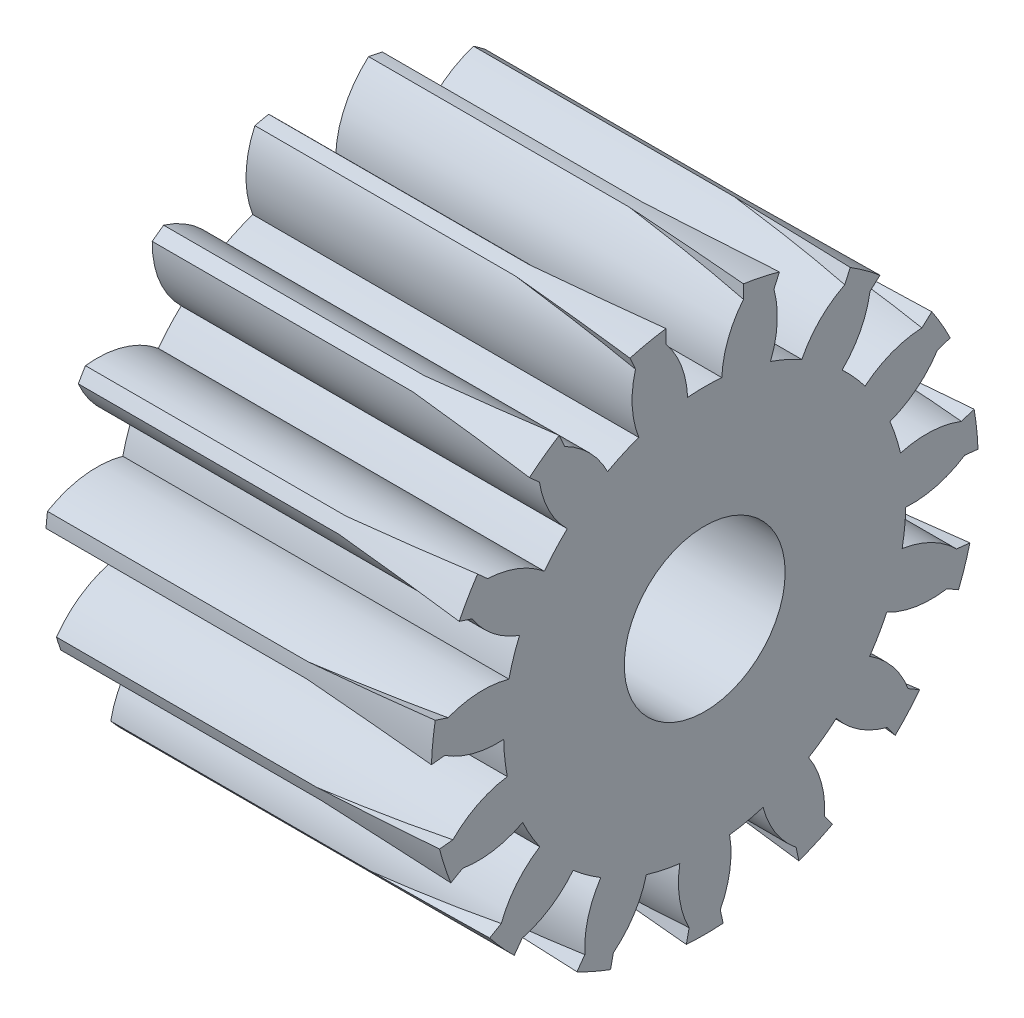
from build123d import *
from build123d.topology import SkipClean

# Parameters (mm, degrees)
BASPROSKE_W                               = 30
BASPROSKE_H                               = 8.5
TOOTHCUT_DEPTH                            = 33.318725222
TEETHCUTS_COUNT                           = 15
TEETHCUTS_ANGLE                           = 336
BORSKE_R                                  = 3
BORE_DEPTH                                = 50.0000508
ESBO_O1_R                                 = 8.5
ESBO_O1_R_2                               = 3
RESSALTO_EXTRUS_O1_DEPTH                  = 10
RESSALTO_EXTRUS_O2_REACH                  = 37.644
RESSALTO_EXTRUS_O2_END_RADIUS             = 6.249
RESSALTO_EXTRUS_O2_DIRECTION_2_REACH      = 37.644
RESSALTO_EXTRUS_O2_DIRECTION_2_END_RADIUS = 8.5
PADR_OCIRCULAR1_COUNT                     = 15
ESBO_O3_R                                 = 4
CORTE_EXTRUS_O1_DEPTH                     = 33.318725368
CHANFRO1_SIZE                             = 0.5
ESBO_O4_R                                 = 12.089126148
CORTE_EXTRUS_O2_DEPTH                     = 2
ESBO_O5_R                                 = 10.551181847
CORTE_EXTRUS_O3_DEPTH                     = 16
RESSALTO_EXTRUS_O3_START                  = -12
ESBO_O6_R                                 = 4
ESBO_O6_R_2                               = 3
RESSALTO_EXTRUS_O3_DEPTH                  = 12
PADR_O_LINEAR2_COUNT                      = 2
PADR_O_LINEAR2_PITCH                      = 1
PADR_O_LINEAR2_COL_COUNT                  = 11
PADR_O_LINEAR2_COL_PITCH                  = 1
ESBO_O10_R                                = 4.09987249
ESBO_O10_R_2                              = 2.5
RESSALTO_EXTRUS_O4_DEPTH                  = 12


# Read off the part's stored shape, not the designer's step: Corte-Revolução3
with BuildPart() as part:
    # BasProSke → Base-Revolve (revolve)
    with BuildSketch(Plane(origin=(0, 0, 0), x_dir=(1, 0, 0), z_dir=(0, 1, 0)), mode=Mode.PRIVATE) as base_revolve_sk:
        with Locations((15, 4.25)):
            Rectangle(BASPROSKE_W, BASPROSKE_H)
    revolve(base_revolve_sk.sketch.rotate(Axis((-10, 0, 0), (1, 0, 0)), 180), axis=Axis((-10, 0, 0), (1, 0, 0)))

    # TooCutSke → ToothCut (cut, through all)
    with BuildSketch(Plane(origin=(0, 0, 0), x_dir=(0, 0, -1), z_dir=(1, 0, 0))):
        with BuildLine():
            ThreePointArc((0.531576138, 6.226349477), (0, 6.249), (-0.531576138, 6.226349477))
            ThreePointArc((-0.531576138, 6.226349477), (-0.830301624, 7.411024729), (-1.576608494, 8.378350125))
            ThreePointArc((-1.576608494, 8.378350125), (0, 8.5254), (1.576608494, 8.378350125))
            ThreePointArc((1.576608494, 8.378350125), (0.830301624, 7.411024729), (0.531576138, 6.226349477))
        make_face()
    toothcut = extrude(amount=TOOTHCUT_DEPTH, mode=Mode.SUBTRACT)

    # TeethCuts: ToothCut ×15 about axis
    teethcuts_axis = Axis((-10, 0, 0), (1, 0, 0))
    for i in range(1, TEETHCUTS_COUNT):
        add(toothcut.rotate(teethcuts_axis, i * TEETHCUTS_ANGLE / (TEETHCUTS_COUNT - 1)), mode=Mode.SUBTRACT)

    # BorSke → Bore (cut, symmetric)
    with BuildSketch(Plane(origin=(0, 0, 0), x_dir=(0, 0, -1), z_dir=(1, 0, 0))):
        with Locations(Location((0, 0, 0), (0, 0, 180))):
            Circle(BORSKE_R)
    extrude(amount=BORE_DEPTH, both=True, mode=Mode.SUBTRACT)

    # Esboço1 → Ressalto-extrusão1 (add)
    with BuildSketch(Plane(origin=(30, 0, 0), x_dir=(0, 0, -1), z_dir=(1, 0, 0))):
        with Locations(Location((0, 0, 0), (0, 0, 180))):
            Circle(ESBO_O1_R)
        with Locations(Location((0, 0, 0), (0, 0, 180))):
            Circle(ESBO_O1_R_2, mode=Mode.SUBTRACT)
    extrude(amount=-RESSALTO_EXTRUS_O1_DEPTH)

    # Ressalto-extrusão2: up to this cylinder (the profile starts outside it)
    ressalto_extrus_o2_end = Plane(origin=(19.989625, 0, 0), z_dir=(-1, 0, 0)) * Cylinder(RESSALTO_EXTRUS_O2_END_RADIUS, 88.786, mode=Mode.PRIVATE)
    # Esboço2 → Ressalto-extrusão2 (add, up to the surface)
    with BuildSketch(Plane(origin=(0, -0.873554359, 8.311314547), x_dir=(1, 0, 0), z_dir=(0, -0.10452846326765765, 0.994521895368273)), mode=Mode.PRIVATE) as ressalto_extrus_o2_sk1:
        with BuildLine():
            Line((20, 1.55208031), (20, -1.55208031))
            Line((20, -1.55208031), (10.1, -1.55208031))
            add(Edge.make_bspline(
                [(10.1, 1.55208031), (29.7, 0), (10.1, -1.55208031)],
                knots=[0, 0, 0, 1, 1, 1], degree=2))
            Line((10.1, 1.55208031), (20, 1.55208031))
        make_face()
    ressalto_extrus_o2_tool1 = extrude(ressalto_extrus_o2_sk1.sketch, amount=-RESSALTO_EXTRUS_O2_REACH, mode=Mode.PRIVATE) - ressalto_extrus_o2_end
    ressalto_extrus_o2 = ressalto_extrus_o2_tool1.solids().sort_by_distance((19.989625, -0.873554, 8.311315))[0]
    add(ressalto_extrus_o2)

    # Ressalto-extrusão2 direction 2: up to this cylinder (the profile starts inside it)
    ressalto_extrus_o2_direction_2_end = Plane(origin=(19.989625, 0, 0), z_dir=(-1, 0, 0)) * Cylinder(RESSALTO_EXTRUS_O2_DIRECTION_2_END_RADIUS, 93.288, mode=Mode.PRIVATE)
    # Esboço2 → Ressalto-extrusão2 direction 2 (add, up to the surface)
    with BuildSketch(Plane(origin=(0, -0.873554359, 8.311314547), x_dir=(1, 0, 0), z_dir=(0, -0.10452846326765765, 0.994521895368273)), mode=Mode.PRIVATE) as ressalto_extrus_o2_direction_2_sk1:
        with BuildLine():
            Line((20, 1.55208031), (20, -1.55208031))
            Line((20, -1.55208031), (10.1, -1.55208031))
            add(Edge.make_bspline(
                [(10.1, 1.55208031), (29.7, 0), (10.1, -1.55208031)],
                knots=[0, 0, 0, 1, 1, 1], degree=2))
            Line((10.1, 1.55208031), (20, 1.55208031))
        make_face()
    ressalto_extrus_o2_direction_2_tool1 = extrude(ressalto_extrus_o2_direction_2_sk1.sketch, amount=RESSALTO_EXTRUS_O2_DIRECTION_2_REACH, mode=Mode.PRIVATE) & ressalto_extrus_o2_direction_2_end
    ressalto_extrus_o2_direction_2 = ressalto_extrus_o2_direction_2_tool1.solids().sort_by_distance((19.989625, -0.873554, 8.311315))[0]
    add(ressalto_extrus_o2_direction_2)
    ressalto_extrus_o2 = ressalto_extrus_o2 + ressalto_extrus_o2_direction_2  # both directions under the feature's name, for the pattern or mirror that repeats it

    # PadrãoCircular1: Ressalto-extrusão2 ×15 about axis
    padr_ocircular1_axis = Axis((0, 0, 0), (1, 0, 0))
    for i in range(1, PADR_OCIRCULAR1_COUNT):
        add(ressalto_extrus_o2.rotate(padr_ocircular1_axis, i * 360 / PADR_OCIRCULAR1_COUNT))

    # Esboço3 → Corte-extrusão1 (cut, through all)
    with BuildSketch(Plane.ZY):
        Circle(ESBO_O3_R)
    extrude(amount=-CORTE_EXTRUS_O1_DEPTH, mode=Mode.SUBTRACT)

    # Chanfro1
    chanfro1_edges = [part.edges().sort_by_distance(p)[0] for p in [
        (30, 6.536156464, 5.434027851),
        (30, 0, -4),
    ]]
    chamfer(chanfro1_edges, length=CHANFRO1_SIZE)

    # Esboço4 → Corte-extrusão2 (cut)
    with BuildSketch(Plane.ZY):
        Circle(ESBO_O4_R)
    extrude(amount=-CORTE_EXTRUS_O2_DEPTH, mode=Mode.SUBTRACT)

    # Esboço5 → Corte-extrusão3 (cut)
    with BuildSketch(Plane(origin=(30, 0, 0), x_dir=(0, 0, -1), z_dir=(1, 0, 0))):
        Circle(ESBO_O5_R)
    extrude(amount=-CORTE_EXTRUS_O3_DEPTH, mode=Mode.SUBTRACT)

    # Esboço6 → Ressalto-extrusão3 (add)
    with BuildSketch(Plane(origin=(14, 0, 0), x_dir=(0, 0, -1), z_dir=(1, 0, 0)).offset(RESSALTO_EXTRUS_O3_START)):
        Circle(ESBO_O6_R)
        Circle(ESBO_O6_R_2, mode=Mode.SUBTRACT)
    extrude(amount=RESSALTO_EXTRUS_O3_DEPTH)

    # Corte-Revolução3 outline → Corte-Revolução3 (revolve, cut)
    with BuildSketch(Plane.YX):
        Polygon((4.018103451, 12.575), (3, 13.007693967), (3, 11.992306033), (4.018103451, 12.425), align=None)
    corte_revolu_o3 = revolve(axis=Axis((0, 0, 0), (1, 0, 0)), mode=Mode.SUBTRACT)

    # Padrão linear2: Corte-Revolução3 ×2
    with SkipClean():  # the faces are left unmerged after this step: merging them gives an invalid solid
        with Locations(*[(i * PADR_O_LINEAR2_PITCH, 0, 0) for i in range(1, PADR_O_LINEAR2_COUNT)]):
            add(corte_revolu_o3, mode=Mode.SUBTRACT)

    # Padrão linear2 col: Corte-Revolução3 ×11
    with SkipClean():  # the faces are left unmerged after this step: merging them gives an invalid solid
        with Locations(*[(-i * PADR_O_LINEAR2_COL_PITCH, 0, 0) for i in range(1, PADR_O_LINEAR2_COL_COUNT)]):
            add(corte_revolu_o3, mode=Mode.SUBTRACT)

    # Esboço10 → Ressalto-extrusão4 (add, through all)
    with SkipClean():  # the faces are left unmerged after this step: merging them gives an invalid solid
        with BuildSketch(Plane(origin=(14, 0, 0), x_dir=(0, 0, -1), z_dir=(1, 0, 0))):
            Circle(ESBO_O10_R)
            Circle(ESBO_O10_R_2, mode=Mode.SUBTRACT)
        extrude(amount=-RESSALTO_EXTRUS_O4_DEPTH)


solid = part.part
